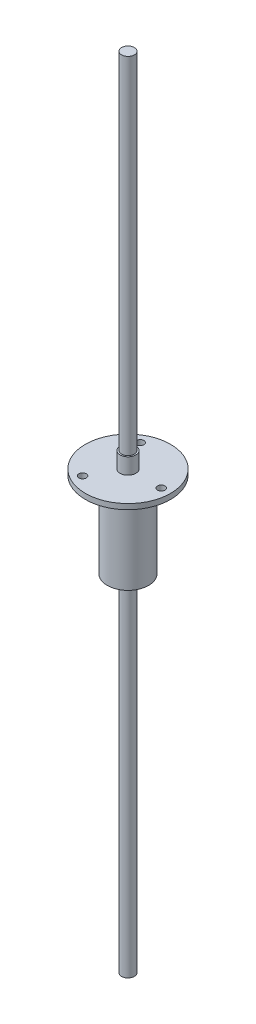
from build123d import *

# Parameters (mm, degrees)
CUT_EXTRUDE1_DEPTH      = 41.924442574
CUT_EXTRUDE1_DEPTH_BACK = 41.924442574
SKETCH2_R               = 1.4
SKETCH3_R               = 2.4
BOSS_EXTRUDE1_DEPTH     = 150


with BuildPart() as part:
    # Sketch1 → Revolve1 (revolve)
    with BuildSketch(Plane(origin=(0, 0, 0), x_dir=(0, 0, -1), z_dir=(1, 0, 0))):
        Polygon((0, 20.05), (2.95, 20.05), (2.95, 14.05), (16, 14.05), (16, 12.05), (7.75, 12.05), (7.75, -20.05), (0, -20.05), align=None)
    revolve(axis=Axis((0, 23.931122449, 0), (0, -1, 0)))

    # Sketch2 → Cut-Extrude1 (cut, two sides: drawn at the far end of the back side and taken through both)
    with BuildSketch(Plane(origin=(0, 14.05, 0), x_dir=(1, 0, 0), z_dir=(0, 1, 0)).offset(-CUT_EXTRUDE1_DEPTH_BACK)):
        with Locations((12.5, 0)):
            Circle(SKETCH2_R)
        with Locations((-6.25, -10.825317547)):
            Circle(SKETCH2_R)
        with Locations((-6.25, 10.825317547)):
            Circle(SKETCH2_R)
    extrude(amount=CUT_EXTRUDE1_DEPTH + CUT_EXTRUDE1_DEPTH_BACK, mode=Mode.SUBTRACT)

    # Sketch3 → Boss-Extrude1 (add, symmetric)
    with BuildSketch(Plane(origin=(0, 0, 0), x_dir=(1, 0, 0), z_dir=(0, 1, 0))):
        Circle(SKETCH3_R)
    extrude(amount=BOSS_EXTRUDE1_DEPTH, both=True)


solid = part.part
